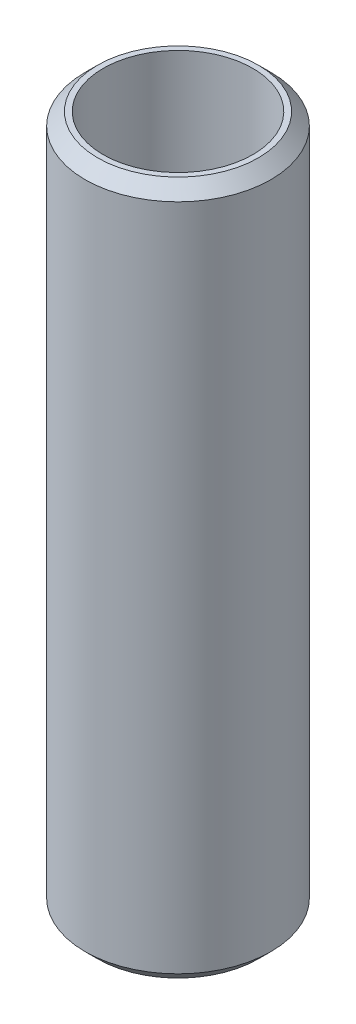
from build123d import *

# Parameters (mm, degrees)
SKETCH1_R           = 27.5
BOSS_EXTRUDE1_DEPTH = 205.301103872
SKETCH2_R           = 22.14298419
CUT_EXTRUDE1_DEPTH  = 209.952251127
CHAMFER1_SIZE       = 3.717850208


with BuildPart() as part:
    # Sketch1 → Boss-Extrude1 (new body)
    with BuildSketch(Plane(origin=(0, 0, 0), x_dir=(1, 0, 0), z_dir=(0, 1, 0))):
        Circle(SKETCH1_R)
    extrude(amount=BOSS_EXTRUDE1_DEPTH)

    # Sketch2 → Cut-Extrude1 (cut, through all)
    with BuildSketch(Plane(origin=(0, 0, 0), x_dir=(1, 0, 0), z_dir=(0, 1, 0))):
        Circle(SKETCH2_R)
    extrude(amount=CUT_EXTRUDE1_DEPTH, mode=Mode.SUBTRACT)

    # Chamfer1
    chamfer1_edges = [part.edges().sort_by_distance(p)[0] for p in [
        (-27.5, 205.301103872, 0),
        (-27.5, 0, 0),
    ]]
    chamfer(chamfer1_edges, length=CHAMFER1_SIZE)


solid = part.part
